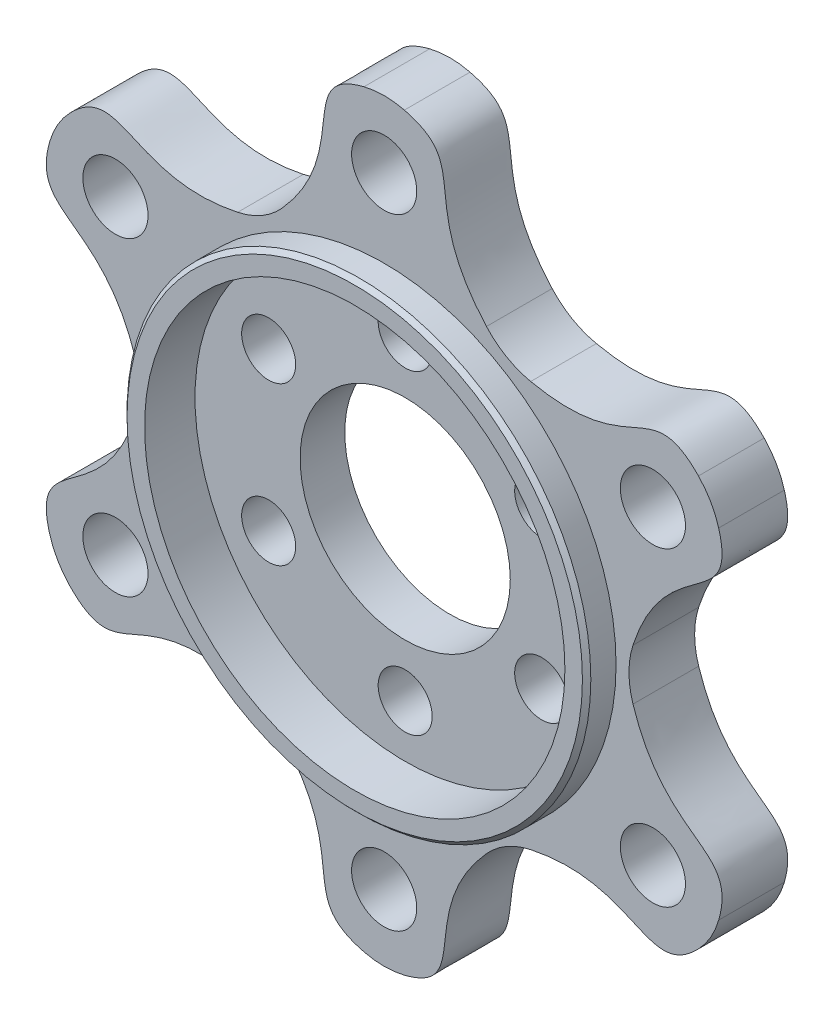
from build123d import *

# Parameters (mm, degrees)
SKETCH1_R           = 45.72
SKETCH1_R_2         = 12.7
SKETCH1_R_3         = 3.2639
SKETCH1_R_4         = 3.937
BOSS_EXTRUDE3_DEPTH = 7.9375
CUT_EXTRUDE1_START  = -22.86
CUT_EXTRUDE1_DEPTH  = 22.86
SKETCH4_R           = 28.025000007
SKETCH4_R_2         = 25.4
BOSS_EXTRUDE4_DEPTH = 3.556
FILLET1_R           = 10
CHAMFER1_SIZE       = 0.508
CUT_EXTRUDE2_START  = -2.54
SKETCH7_R           = 25.4
CUT_EXTRUDE2_DEPTH  = 2.54


with BuildPart() as part:
    # Sketch1 → Boss-Extrude3 (new body)
    with BuildSketch(Plane.XY):
        Circle(SKETCH1_R)
        Circle(SKETCH1_R_2, mode=Mode.SUBTRACT)
        with Locations((0, 19.05)):
            Circle(SKETCH1_R_3, mode=Mode.SUBTRACT)
        with Locations((16.497783942, 9.525)):
            Circle(SKETCH1_R_3, mode=Mode.SUBTRACT)
        with Locations((16.497783942, -9.525)):
            Circle(SKETCH1_R_3, mode=Mode.SUBTRACT)
        with Locations((0, -19.05)):
            Circle(SKETCH1_R_3, mode=Mode.SUBTRACT)
        with Locations((-16.497783942, -9.525)):
            Circle(SKETCH1_R_3, mode=Mode.SUBTRACT)
        with Locations((-16.497783942, 9.525)):
            Circle(SKETCH1_R_3, mode=Mode.SUBTRACT)
        with Locations((0, 37.5)):
            Circle(SKETCH1_R_4, mode=Mode.SUBTRACT)
        with Locations((32.475952642, 18.75)):
            Circle(SKETCH1_R_4, mode=Mode.SUBTRACT)
        with Locations((32.475952642, -18.75)):
            Circle(SKETCH1_R_4, mode=Mode.SUBTRACT)
        with Locations((0, -37.5)):
            Circle(SKETCH1_R_4, mode=Mode.SUBTRACT)
        with Locations((-32.475952642, -18.75)):
            Circle(SKETCH1_R_4, mode=Mode.SUBTRACT)
        with Locations((-32.475952642, 18.75)):
            Circle(SKETCH1_R_4, mode=Mode.SUBTRACT)
    extrude(amount=BOSS_EXTRUDE3_DEPTH)

    # Sketch2 → Cut-Extrude1 (cut)
    with BuildSketch(Plane.XY.offset(7.9375).offset(CUT_EXTRUDE1_START)):
        with BuildLine():
            ThreePointArc((39.594681461, -22.86), (45.72, 0), (39.594681461, 22.86))
            add(Edge.make_bspline(
                [(29.25, 0), (32.932092251, 17.195322725), (44.628878831, 10.61767176), (39.594681461, 22.86)],
                knots=[0, 0, 0, 0, 1, 1, 1, 1], degree=3))
            add(Edge.make_bspline(
                [(29.25, 0), (32.932092251, -17.195322725), (44.628878831, -10.61767176), (39.594681461, -22.86)],
                knots=[0, 0, 0, 0, 1, 1, 1, 1], degree=3))
        make_face()
        with BuildLine():
            add(Edge.make_bspline(
                [(14.625, 25.331243061), (31.357632431, 19.922367126), (31.509612889, 33.34090693), (39.594681461, 22.86)],
                knots=[0, 0, 0, 0, 1, 1, 1, 1], degree=3))
            ThreePointArc((39.594681461, 22.86), (22.86, 39.594681461), (0, 45.72))
            add(Edge.make_bspline(
                [(14.625, 25.331243061), (1.574459819, 37.117689851), (13.119265943, 43.95857869), (0, 45.72)],
                knots=[0, 0, 0, 0, 1, 1, 1, 1], degree=3))
        make_face()
        with BuildLine():
            ThreePointArc((0, -45.72), (22.86, -39.594681461), (39.594681461, -22.86))
            add(Edge.make_bspline(
                [(14.625, -25.331243061), (31.357632431, -19.922367126), (31.509612889, -33.34090693), (39.594681461, -22.86)],
                knots=[0, 0, 0, 0, 1, 1, 1, 1], degree=3))
            add(Edge.make_bspline(
                [(14.625, -25.331243061), (1.574459819, -37.117689851), (13.119265943, -43.95857869), (0, -45.72)],
                knots=[0, 0, 0, 0, 1, 1, 1, 1], degree=3))
        make_face()
        with BuildLine():
            add(Edge.make_bspline(
                [(-14.625, 25.331243061), (-1.574459819, 37.117689851), (-13.119265943, 43.95857869), (0, 45.72)],
                knots=[0, 0, 0, 0, 1, 1, 1, 1], degree=3))
            ThreePointArc((0, 45.72), (-22.86, 39.594681461), (-39.594681461, 22.86))
            add(Edge.make_bspline(
                [(-14.625, 25.331243061), (-31.357632431, 19.922367126), (-31.509612889, 33.34090693), (-39.594681461, 22.86)],
                knots=[0, 0, 0, 0, 1, 1, 1, 1], degree=3))
        make_face()
        with BuildLine():
            ThreePointArc((-39.594681461, -22.86), (-22.86, -39.594681461), (0, -45.72))
            add(Edge.make_bspline(
                [(-14.625, -25.331243061), (-1.574459819, -37.117689851), (-13.119265943, -43.95857869), (0, -45.72)],
                knots=[0, 0, 0, 0, 1, 1, 1, 1], degree=3))
            add(Edge.make_bspline(
                [(-14.625, -25.331243061), (-31.357632431, -19.922367126), (-31.509612889, -33.34090693), (-39.594681461, -22.86)],
                knots=[0, 0, 0, 0, 1, 1, 1, 1], degree=3))
        make_face()
        with BuildLine():
            add(Edge.make_bspline(
                [(-29.25, 0), (-32.932092251, 17.195322725), (-44.628878831, 10.61767176), (-39.594681461, 22.86)],
                knots=[0, 0, 0, 0, 1, 1, 1, 1], degree=3))
            ThreePointArc((-39.594681461, 22.86), (-45.72, 0), (-39.594681461, -22.86))
            add(Edge.make_bspline(
                [(-29.25, 0), (-32.932092251, -17.195322725), (-44.628878831, -10.61767176), (-39.594681461, -22.86)],
                knots=[0, 0, 0, 0, 1, 1, 1, 1], degree=3))
        make_face()
    extrude(amount=CUT_EXTRUDE1_DEPTH, mode=Mode.SUBTRACT)

    # Sketch4 → Boss-Extrude4 (add)
    with BuildSketch(Plane.XY.offset(7.9375)):
        Circle(SKETCH4_R)
        Circle(SKETCH4_R_2, mode=Mode.SUBTRACT)
    extrude(amount=BOSS_EXTRUDE4_DEPTH)

    # Fillet1
    fillet1_edges = [part.edges().sort_by_distance(p)[0] for p in [
        (29.25, 0, 3.96875),
        (39.594681461, -22.86, 3.96875),
        (0, -45.72, 3.96875),
        (14.625, -25.331243061, 3.96875),
        (-14.625, -25.331243061, 3.96875),
        (-39.594681461, -22.86, 3.96875),
        (-29.25, 0, 3.96875),
        (-39.594681461, 22.86, 3.96875),
        (-14.625, 25.331243061, 3.96875),
        (14.625, 25.331243061, 3.96875),
        (39.594681461, 22.86, 3.96875),
        (0, 45.72, 3.96875),
    ]]
    fillet(fillet1_edges, radius=FILLET1_R)

    # Chamfer1
    chamfer1_edges = [part.edges().sort_by_distance(p)[0] for p in [
        (-28.025000007, 0, 11.4935),
    ]]
    chamfer(chamfer1_edges, length=CHAMFER1_SIZE)

    # Sketch7 → Cut-Extrude2 (cut)
    with BuildSketch(Plane.XY.offset(7.9375).offset(CUT_EXTRUDE2_START)):
        Circle(SKETCH7_R)
    extrude(amount=CUT_EXTRUDE2_DEPTH, mode=Mode.SUBTRACT)


solid = part.part
